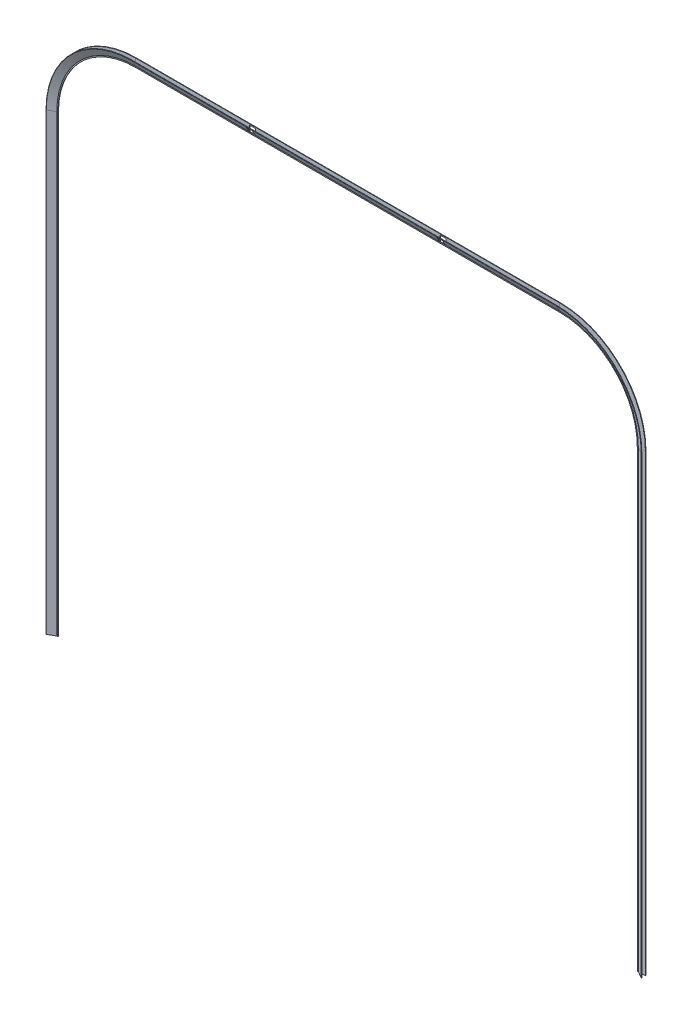
from build123d import *

# Parameters (mm, degrees)
FILLET1_R          = 1
SKETCH3_W          = 22
SKETCH3_H          = 22
CUT_EXTRUDE1_DEPTH = 2934.613813656


with BuildPart() as part:
    # Sweep1: sweep along a path in Sketch1
    with BuildLine(Plane.XY) as sweep1_path:
        Line((0, 0), (0, 1670))
        ThreePointArc((0, 1670), (83.474567362, 1871.525432638), (285, 1955))
        Line((285, 1955), (1845, 1955))
        ThreePointArc((1845, 1955), (2046.525432638, 1871.525432638), (2130, 1670))
        Line((2130, 1670), (2130, 0))
    # Sketch2 → Sweep1 (sweep)
    with BuildSketch(Plane(origin=(0, 0, 0), x_dir=(1, 0, 0), z_dir=(0, 1, 0))):
        Polygon((0, 0), (0, -2), (-4, -2), (-30, -17.011106999), (-30, -15.011106999), (-7.464101615, -2), (-30, -2), (-30, 0), align=None)
    sweep(path=sweep1_path.line)

    # Fillet1
    # the kernel refuses this fillet: 1 mm, written as the material it adds along each edge
    with BuildSketch(Plane(origin=(2134, 1670, 2), x_dir=(-1.0, -6.753186657693947e-15, -1.7725502571054264e-12), z_dir=(0, -1, 0))) as fillet1_piece_1:
        with BuildLine():
            CenterArc((FILLET1_R * 0.267949192429, -FILLET1_R), FILLET1_R, 90, 30)
            Line((-FILLET1_R * 0.232050807569, -FILLET1_R * 0.133974596215), (0, 0))
            Line((0, 0), (FILLET1_R * 0.267949192431, 0))
        make_face()
    extrude(amount=1670)
    with BuildSketch(Plane(origin=(1845, 1670, 2), x_dir=(0, 1, 0), z_dir=(-1, 0, 0))) as fillet1_piece_2:
        with BuildLine():
            CenterArc((289 - FILLET1_R * 0.267949192431, -FILLET1_R), FILLET1_R, 60, 30)
            Line((289 + FILLET1_R * 0.232050807569, -FILLET1_R * 0.133974596215), (289, 0))
            Line((289, 0), (289 - FILLET1_R * 0.267949192431, 0))
        make_face()
    revolve(axis=Axis((1845, 1670, 2), (0, 0, -1)), revolution_arc=90)
    with BuildSketch(Plane(origin=(285, 1959, 2), x_dir=(0, -1, 0), z_dir=(1, 0, 0))) as fillet1_piece_3:
        with BuildLine():
            CenterArc((FILLET1_R * 0.267949192431, -FILLET1_R), FILLET1_R, 90, 30)
            Line((-FILLET1_R * 0.232050807569, -FILLET1_R * 0.133974596215), (0, 0))
            Line((0, 0), (FILLET1_R * 0.267949192431, 0))
        make_face()
    extrude(amount=1560)
    with BuildSketch(Plane(origin=(285, 1670, 2), x_dir=(-1, 0, 0), z_dir=(0, -1, 0))) as fillet1_piece_4:
        with BuildLine():
            CenterArc((289 - FILLET1_R * 0.267949192431, -FILLET1_R), FILLET1_R, 60, 30)
            Line((289 + FILLET1_R * 0.232050807569, -FILLET1_R * 0.133974596216), (289, 0))
            Line((289, 0), (289 - FILLET1_R * 0.267949192431, 0))
        make_face()
    revolve(axis=Axis((285, 1670, 2), (0, 0, -1)), revolution_arc=90)
    with BuildSketch(Plane(origin=(2137.464101615, 1670, 2), x_dir=(1, 0, 0), z_dir=(0, -1, 0)), Plane(origin=(-7.464101615, 0, 2), x_dir=(-1, 0, 0), z_dir=(0, 1, 0))) as fillet1_piece_5:
        with BuildLine():
            CenterArc((FILLET1_R * 3.73205080757, FILLET1_R), FILLET1_R, 120, 150)
            Line((FILLET1_R * 3.23205080757, FILLET1_R * 1.86602540378), (0, 0))
            Line((0, 0), (FILLET1_R * 3.73205080757, 0))
        make_face()
    extrude(amount=1670)
    with BuildSketch(Plane(origin=(1845, 1670, 2), x_dir=(0, 1, 0), z_dir=(-1, 0, 0))) as fillet1_piece_6:
        with BuildLine():
            CenterArc((292.464101615 + FILLET1_R * 3.73205080757, -FILLET1_R), FILLET1_R, 90, 150)
            Line((292.464101615 + FILLET1_R * 3.23205080757, -FILLET1_R * 1.86602540378), (292.464101615, 0))
            Line((292.464101615, 0), (292.464101615 + FILLET1_R * 3.73205080757, 0))
        make_face()
    revolve(axis=Axis((1845, 1670, 2), (0, 0, -1)), revolution_arc=90)
    with BuildSketch(Plane(origin=(285, 1962.464101615, 2), x_dir=(0, 1, 0), z_dir=(1, 0, 0))) as fillet1_piece_7:
        with BuildLine():
            CenterArc((FILLET1_R * 3.73205080757, FILLET1_R), FILLET1_R, 120, 150)
            Line((FILLET1_R * 3.23205080757, FILLET1_R * 1.86602540378), (0, 0))
            Line((0, 0), (FILLET1_R * 3.73205080757, 0))
        make_face()
    extrude(amount=1560)
    with BuildSketch(Plane(origin=(285, 1670, 2), x_dir=(-1, 0, 0), z_dir=(0, -1, 0))) as fillet1_piece_8:
        with BuildLine():
            CenterArc((292.464101615 + FILLET1_R * 3.73205080757, -FILLET1_R), FILLET1_R, 90, 150)
            Line((292.464101615 + FILLET1_R * 3.23205080757, -FILLET1_R * 1.86602540378), (292.464101615, 0))
            Line((292.464101615, 0), (292.464101615 + FILLET1_R * 3.73205080757, 0))
        make_face()
    revolve(axis=Axis((285, 1670, 2), (0, 0, -1)), revolution_arc=90)
    with BuildSketch(Plane(origin=(-4, 0, 2), x_dir=(-0.8660254037844416, 0, 0.499999999999995), z_dir=(0, 1, 0))) as fillet1_piece_9:
        with BuildLine():
            CenterArc((FILLET1_R * 0.267949192431, FILLET1_R), FILLET1_R, 240, 30)
            Line((-FILLET1_R * 0.232050807569, FILLET1_R * 0.133974596216), (0, 0))
            Line((0, 0), (FILLET1_R * 0.267949192431, 0))
        make_face()
    extrude(amount=1670)
    # the kernel refuses this fillet: 1 mm, written as the material it takes off along each edge
    with BuildSketch(Plane(origin=(2160, 1670, 15.011106999), x_dir=(-0.8660254037844758, -7.797908269406777e-15, -0.49999999999993566), z_dir=(0, -1, 0)), Plane(origin=(-30, -1.443375673, 15.011106999), x_dir=(0.8660254037844414, 0, -0.4999999999999953), z_dir=(0, 1, 0))) as fillet1_2_piece_1:
        with BuildLine():
            CenterArc((FILLET1_R * 0.57735026919, -FILLET1_R), FILLET1_R, 90, 60)
            Line((-FILLET1_R * 0.288675134595, -FILLET1_R * 0.5), (0, 0))
            Line((0, 0), (FILLET1_R * 0.57735026919, 0))
        make_face()
    extrude(amount=1671.443375673, mode=Mode.SUBTRACT)
    with BuildSketch(Plane(origin=(1845, 1670, 15.011106999), x_dir=(0, 1, 0), z_dir=(-1, 0, 0))) as fillet1_2_piece_2:
        with BuildLine():
            CenterArc((315 - FILLET1_R, -FILLET1_R * 0.57735026919), FILLET1_R, 0, 60)
            Line((315 - FILLET1_R * 0.5, FILLET1_R * 0.288675134595), (315, 0))
            Line((315, 0), (315, -FILLET1_R * 0.57735026919))
        make_face()
    revolve(axis=Axis((1845, 1670, 15.011106999), (0, 0, -1)), revolution_arc=90, mode=Mode.SUBTRACT)
    with BuildSketch(Plane(origin=(285, 1985, 15.011106999), x_dir=(0, 0, 1), z_dir=(1, 0, 0))) as fillet1_2_piece_3:
        with BuildLine():
            CenterArc((FILLET1_R * 0.57735026919, FILLET1_R), FILLET1_R, 210, 60)
            Line((-FILLET1_R * 0.288675134595, FILLET1_R * 0.5), (0, 0))
            Line((0, 0), (FILLET1_R * 0.57735026919, 0))
        make_face()
    extrude(amount=1560, mode=Mode.SUBTRACT)
    with BuildSketch(Plane(origin=(285, 1670, 15.011106999), x_dir=(-1, 0, 0), z_dir=(0, -1, 0))) as fillet1_2_piece_4:
        with BuildLine():
            CenterArc((315 - FILLET1_R, -FILLET1_R * 0.57735026919), FILLET1_R, 0, 60)
            Line((315, -FILLET1_R * 0.57735026919), (315, 0))
            Line((315, 0), (315 - FILLET1_R * 0.5, FILLET1_R * 0.288675134595))
        make_face()
    revolve(axis=Axis((285, 1670, 15.011106999), (0, 0, -1)), revolution_arc=90, mode=Mode.SUBTRACT)
    with BuildSketch(Plane(origin=(2160, 1670, 17.011106999), x_dir=(-0.8660254037844523, 0, -0.4999999999999764), z_dir=(0, -1, 0))) as fillet1_2_piece_5:
        with BuildLine():
            CenterArc((FILLET1_R * 1.73205080757, FILLET1_R), FILLET1_R, 150, 120)
            Line((FILLET1_R * 0.866025403784, FILLET1_R * 1.5), (0, 0))
            Line((0, 0), (FILLET1_R * 1.73205080757, 0))
        make_face()
    extrude(amount=1674.330127019, mode=Mode.SUBTRACT)
    with BuildSketch(Plane(origin=(1845, 1670, 17.011106999), x_dir=(0, 1, 0), z_dir=(-1, 0, 0))) as fillet1_2_piece_6:
        with BuildLine():
            CenterArc((315 - FILLET1_R, FILLET1_R * 1.73205080757), FILLET1_R, 240, 120)
            Line((315, FILLET1_R * 1.73205080757), (315, 0))
            Line((315, 0), (315 - FILLET1_R * 1.5, FILLET1_R * 0.866025403784))
        make_face()
    revolve(axis=Axis((1845, 1670, 17.011106999), (0, 0, -1)), revolution_arc=90, mode=Mode.SUBTRACT)
    with BuildSketch(Plane(origin=(285, 1985, 17.011106999), x_dir=(0, -0.8660254037844523, -0.4999999999999764), z_dir=(1, 0, 0))) as fillet1_2_piece_7:
        with BuildLine():
            CenterArc((FILLET1_R * 1.73205080757, FILLET1_R), FILLET1_R, 150, 120)
            Line((FILLET1_R * 0.866025403784, FILLET1_R * 1.5), (0, 0))
            Line((0, 0), (FILLET1_R * 1.73205080757, 0))
        make_face()
    extrude(amount=1560, mode=Mode.SUBTRACT)
    with BuildSketch(Plane(origin=(285, 1670, 17.011106999), x_dir=(-1, 0, 0), z_dir=(0, -1, 0))) as fillet1_2_piece_8:
        with BuildLine():
            CenterArc((315 - FILLET1_R, FILLET1_R * 1.73205080757), FILLET1_R, 240, 120)
            Line((315, FILLET1_R * 1.73205080757), (315, 0))
            Line((315, 0), (315 - FILLET1_R * 1.5, FILLET1_R * 0.866025403784))
        make_face()
    revolve(axis=Axis((285, 1670, 17.011106999), (0, 0, -1)), revolution_arc=90, mode=Mode.SUBTRACT)
    with BuildSketch(Plane(origin=(-30, -4.330127019, 17.011106999), x_dir=(0, 0, -1), z_dir=(0, 1, 0))) as fillet1_2_piece_9:
        with BuildLine():
            CenterArc((FILLET1_R * 1.73205080757, -FILLET1_R), FILLET1_R, 90, 120)
            Line((FILLET1_R * 0.866025403784, -FILLET1_R * 1.5), (0, 0))
            Line((0, 0), (FILLET1_R * 1.73205080757, 0))
        make_face()
    extrude(amount=1674.330127019, mode=Mode.SUBTRACT)

    # Sketch3 → Cut-Extrude1 (cut, through all)
    with BuildSketch(Plane(origin=(0, 0, 0), x_dir=(-1, 0, 0), z_dir=(0, 0, -1))):
        with Locations((-1415, 1970)):
            Rectangle(SKETCH3_W, SKETCH3_H)
        with Locations((-715, 1970)):
            Rectangle(SKETCH3_W, SKETCH3_H)
    extrude(amount=-CUT_EXTRUDE1_DEPTH, mode=Mode.SUBTRACT)


solid = part.part
